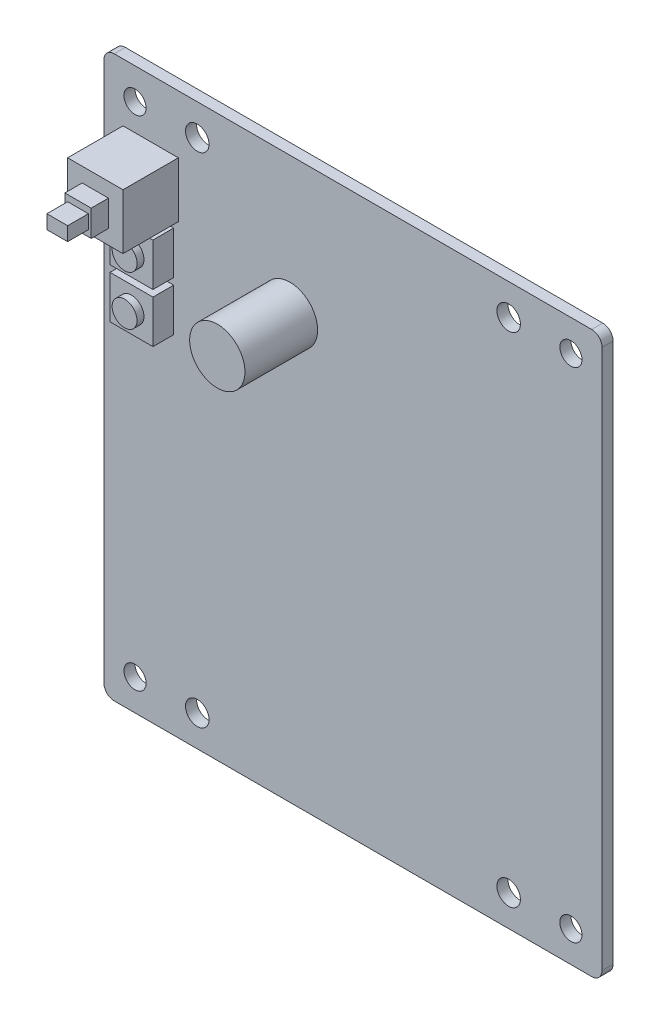
from build123d import *

# Parameters (mm, degrees)
MODEL_R                 = 1.600279216
MODEL_R_2               = 1.7
SALIENTE_EXTRUIR1_DEPTH = 1.6
CROQUIS3_W              = 8
CROQUIS3_H              = 8
SALIENTE_EXTRUIR2_DEPTH = 8
CROQUIS4_W              = 3.8
CROQUIS4_H              = 3.8
SALIENTE_EXTRUIR3_DEPTH = 2.5
CROQUIS5_W              = 3
CROQUIS5_H              = 2
SALIENTE_EXTRUIR4_DEPTH = 3
CROQUIS6_W              = 6.2
CROQUIS6_H              = 6.2
SALIENTE_EXTRUIR5_DEPTH = 3
CROQUIS7_R              = 1.8
SALIENTE_EXTRUIR6_DEPTH = 1
CROQUIS8_R              = 4
SALIENTE_EXTRUIR7_DEPTH = 10.5


with BuildPart() as part:
    # Model → Saliente-Extruir1 (new body)
    with BuildSketch(Plane.XY):
        with BuildLine():
            ThreePointArc((77.569803803, 219.103820632), (78.630463975, 219.54316046), (79.069803803, 220.603820632))
            Line((79.069803803, 220.603820632), (79.069803803, 298.60843049))
            ThreePointArc((79.069803803, 298.60843049), (78.630463975, 299.669090662), (77.569803803, 300.10843049))
            Line((77.569803803, 300.10843049), (8.567399569, 300.10843049))
            ThreePointArc((8.567399569, 300.10843049), (7.506739397, 299.669090662), (7.067399569, 298.60843049))
            Line((7.067399569, 298.60843049), (7.067399569, 220.603820632))
            ThreePointArc((7.067399569, 220.603820632), (7.506739397, 219.54316046), (8.567399569, 219.103820632))
            Line((8.567399569, 219.103820632), (77.569803803, 219.103820632))
        make_face()
        with Locations((11.567065067, 223.60348613)):
            Circle(MODEL_R, mode=Mode.SUBTRACT)
        with Locations((20.566730565, 223.60348613)):
            Circle(MODEL_R_2, mode=Mode.SUBTRACT)
        with Locations((65.570138305, 223.60348613)):
            Circle(MODEL_R_2, mode=Mode.SUBTRACT)
        with Locations((74.569803803, 223.60348613)):
            Circle(MODEL_R, mode=Mode.SUBTRACT)
        with Locations((11.567065067, 295.60843049)):
            Circle(MODEL_R, mode=Mode.SUBTRACT)
        with Locations((20.566730565, 295.60843049)):
            Circle(MODEL_R_2, mode=Mode.SUBTRACT)
        with Locations((65.570138305, 295.60843049)):
            Circle(MODEL_R_2, mode=Mode.SUBTRACT)
        with Locations((74.569803803, 295.60843049)):
            Circle(MODEL_R, mode=Mode.SUBTRACT)
    extrude(amount=SALIENTE_EXTRUIR1_DEPTH)

    # Croquis3 → Saliente-Extruir2 (add)
    with BuildSketch(Plane.XY.offset(1.6)):
        with Locations((13.830317099, 287.72388019)):
            Rectangle(CROQUIS3_W, CROQUIS3_H)
    extrude(amount=SALIENTE_EXTRUIR2_DEPTH)

    # Croquis4 → Saliente-Extruir3 (add)
    with BuildSketch(Plane.XY.offset(9.6)):
        with Locations((13.830317099, 287.72388019)):
            Rectangle(CROQUIS4_W, CROQUIS4_H)
    extrude(amount=SALIENTE_EXTRUIR3_DEPTH)

    # Croquis5 → Saliente-Extruir4 (add)
    with BuildSketch(Plane.XY.offset(12.1)):
        with Locations((13.830317099, 287.72388019)):
            Rectangle(CROQUIS5_W, CROQUIS5_H)
    extrude(amount=SALIENTE_EXTRUIR4_DEPTH)

    # Croquis6 → Saliente-Extruir5 (add)
    with BuildSketch(Plane.XY.offset(1.6)):
        with Locations((14.057658359, 279.49514286)):
            Rectangle(CROQUIS6_W, CROQUIS6_H)
        with Locations((14.057658359, 272.34976915)):
            Rectangle(CROQUIS6_W, CROQUIS6_H)
    extrude(amount=SALIENTE_EXTRUIR5_DEPTH)

    # Croquis7 → Saliente-Extruir6 (add)
    with BuildSketch(Plane.XY.offset(4.6)):
        with Locations((14.057658359, 279.49514286)):
            Circle(CROQUIS7_R)
        with Locations((14.057658359, 272.34976915)):
            Circle(CROQUIS7_R)
    extrude(amount=SALIENTE_EXTRUIR6_DEPTH)

    # Croquis8 → Saliente-Extruir7 (add)
    with BuildSketch(Plane.XY.offset(1.6)):
        with Locations((33.962054569, 280.21944679)):
            Circle(CROQUIS8_R)
    extrude(amount=SALIENTE_EXTRUIR7_DEPTH)


solid = part.part
